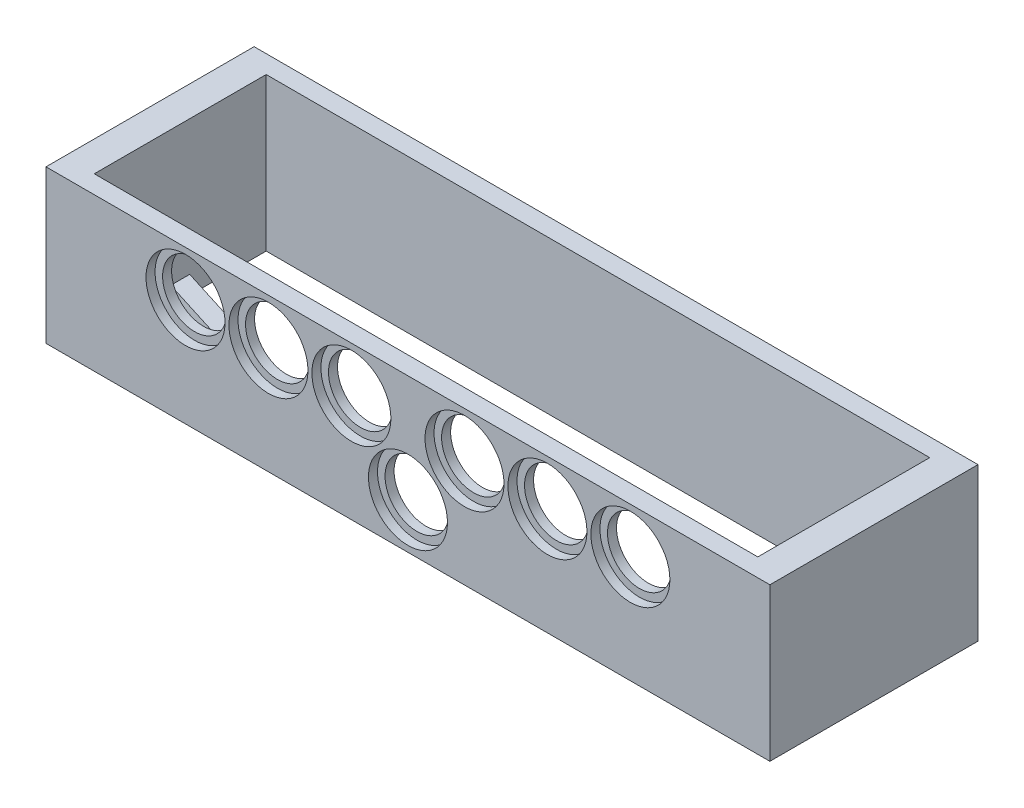
from build123d import *

# Parameters (mm, degrees)
SKICA1_W                 = 240
SKICA1_H                 = 69
SKICA1_W_2               = 220
SKICA1_H_2               = 57
P_IDAT_VYSUNUT_M1_DEPTH  = 50.7
SKICA2_R                 = 13.1
ODEBRAT_VYSUNUT_M1_DEPTH = 3
SKICA4_R                 = 10.6
ODEBRAT_VYSUNUT_M2_DEPTH = 6
P_IDAT_VYSUNUT_M2_DEPTH  = 6


with BuildPart() as part:
    # Skica1 → Přidat vysunutím1 (new body)
    with BuildSketch(Plane(origin=(0, 0, 0), x_dir=(1, 0, 0), z_dir=(0, 1, 0))):
        with Locations((120, 34.5)):
            Rectangle(SKICA1_W, SKICA1_H)
        with Locations((120, 34.5)):
            Rectangle(SKICA1_W_2, SKICA1_H_2, mode=Mode.SUBTRACT)
    extrude(amount=P_IDAT_VYSUNUT_M1_DEPTH)

    # Skica2 → Odebrat vysunutím1 (cut)
    with BuildSketch(Plane.XY):
        with Locations((46.25, 35.6)):
            Circle(SKICA2_R)
        with Locations((73.75, 35.6)):
            Circle(SKICA2_R)
        with Locations((101.25, 35.6)):
            Circle(SKICA2_R)
        with Locations((138.75, 35.6)):
            Circle(SKICA2_R)
        with Locations((166.25, 35.6)):
            Circle(SKICA2_R)
        with Locations((193.75, 35.6)):
            Circle(SKICA2_R)
        with Locations((120, 15.1)):
            Circle(SKICA2_R)
    extrude(amount=-ODEBRAT_VYSUNUT_M1_DEPTH, mode=Mode.SUBTRACT)

    # Skica4 → Odebrat vysunutím2 (cut)
    with BuildSketch(Plane.XY):
        with Locations((46.25, 35.6)):
            Circle(SKICA4_R)
        with Locations((73.75, 35.6)):
            Circle(SKICA4_R)
        with Locations((138.75, 35.6)):
            Circle(SKICA4_R)
        with Locations((101.25, 35.6)):
            Circle(SKICA4_R)
        with Locations((120, 15.1)):
            Circle(SKICA4_R)
        with Locations((166.25, 35.6)):
            Circle(SKICA4_R)
        with Locations((193.75, 35.6)):
            Circle(SKICA4_R)
    extrude(amount=-ODEBRAT_VYSUNUT_M2_DEPTH, mode=Mode.SUBTRACT)

    # Skica5 → Přidat vysunutím2 (add)
    with BuildSketch(Plane.XZ):
        Polygon((90.869565217, -6), (10, -31.363636364), (10, -37.653636364), (110.924637681, -6), align=None)
        Polygon((149.130434783, -6), (129.075362319, -6), (230, -37.653636364), (230, -31.363636364), align=None)
    extrude(amount=-P_IDAT_VYSUNUT_M2_DEPTH)


solid = part.part
